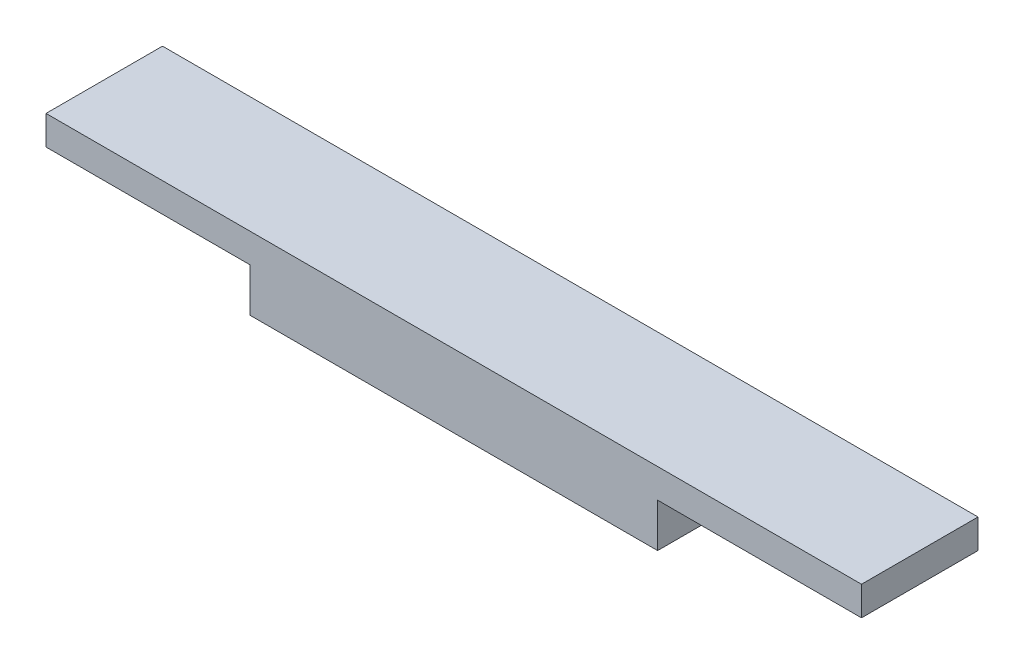
from build123d import *

# Parameters (mm, degrees)
EXTRUDE1_DEPTH      = 12.7
EXTRUDE1_DEPTH_BACK = 12.7


with BuildPart() as part:
    # Sketch1 → Extrude1 (new, two sides: drawn at the far end of the back side and taken through both)
    with BuildSketch(Plane.XY.offset(-EXTRUDE1_DEPTH_BACK)):
        Polygon((-76.2, 0), (101.6, 0), (101.6, -6.35), (57.15, -6.35), (57.15, -15.875), (-31.75, -15.875), (-31.75, -6.35), (-76.2, -6.35), align=None)
    extrude(amount=EXTRUDE1_DEPTH + EXTRUDE1_DEPTH_BACK)


solid = part.part
